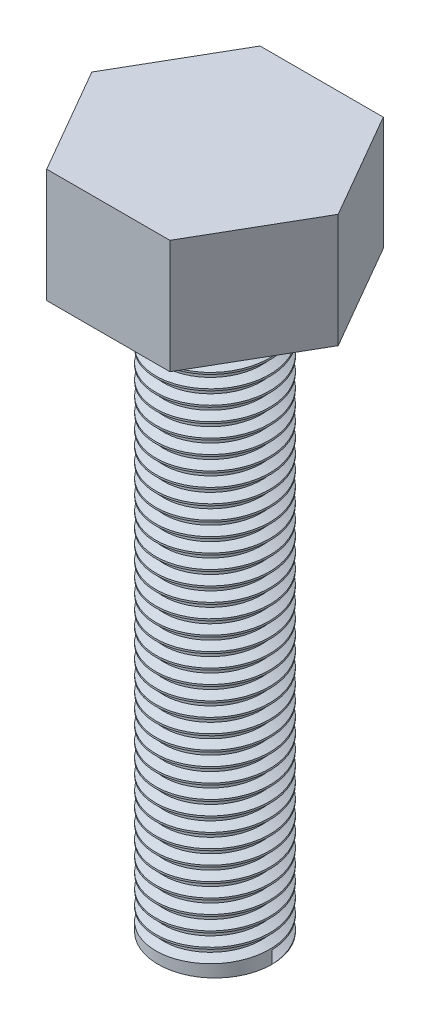
from build123d import *

# Parameters (mm, degrees)
SKETCH1_R           = 4
BOSS_EXTRUDE1_DEPTH = 40
BOSS_EXTRUDE2_DEPTH = 8
THREAD1_PITCH       = 1


with BuildPart() as part:
    # Sketch1 → Boss-Extrude1 (new body)
    with BuildSketch(Plane(origin=(0, 0, 0), x_dir=(1, 0, 0), z_dir=(0, 1, 0))):
        with Locations(Location((0, 0, 0), (0, 0, 270))):
            Circle(SKETCH1_R)
    extrude(amount=-BOSS_EXTRUDE1_DEPTH)

    # Sketch2 → Boss-Extrude2 (add)
    with BuildSketch(Plane(origin=(0, 0, 0), x_dir=(1, 0, 0), z_dir=(0, 1, 0))):
        Polygon((-8.660254038, 0), (-4.330127019, -7.5), (4.330127019, -7.5), (8.660254038, 0), (4.330127019, 7.5), (-4.330127019, 7.5), align=None)
    extrude(amount=BOSS_EXTRUDE2_DEPTH)

    # Thread1: arcs per turn and ends read off the stored shape
    # Thread1: the profile of Thread Profile1 profile screwed along a right-hand helix through 40 turns, 8 arcs to a turn; built about Z, then put on its axis
    thread1_z = Axis((0, 0, 0), (0, 0, 1))
    thread1_corners = [(4.0003, 0, -0.000173205), (4.0003, 0, 0.875173202), (3.458734125, 0, 0.562499999), (3.458734125, 0, 0.312499999)]
    with BuildLine(mode=Mode.PRIVATE) as thread1_profile:
        Line(thread1_corners[0], thread1_corners[1])
        Line(thread1_corners[1], thread1_corners[2])
        Line(thread1_corners[2], thread1_corners[3])
        Line(thread1_corners[3], thread1_corners[0])
    thread1_cap = Face(thread1_profile.wire())
    thread1_turn_angles = [0, 22.5, 45, 67.5, 90, 112.5, 135, 157.5, 180, 202.5, 225, 247.5, 270, 292.5, 315, 337.5, 360]
    thread1_turn_weights = [1, 0.9238795325112867, 1, 0.9238795325112867, 1, 0.9238795325112867, 1, 0.9238795325112867, 1, 0.9238795325112867, 1, 0.9238795325112867, 1, 0.9238795325112867, 1, 0.9238795325112867, 1]
    thread1_turn_rails = [Edge.make_bspline([Vector(p[0], p[1], 0).rotate(thread1_z, thread1_turn_angles[k]) / thread1_turn_weights[k] + Vector(0, 0, p[2] + THREAD1_PITCH * thread1_turn_angles[k] / 360) for k in range(17)], [0, 0, 0, 1, 1, 2, 2, 3, 3, 4, 4, 5, 5, 6, 6, 7, 7, 8, 8, 8], 2, thread1_turn_weights) for p in thread1_corners]
    thread1_turn_sides = [Face.make_surface_from_curves(thread1_turn_rails[p[0]], thread1_turn_rails[p[1]]) for p in [(0, 1), (1, 2), (2, 3), (3, 0)]]
    thread1 = Plane(origin=(0, -40, 0), x_dir=(1, 0, 0), z_dir=(0, 1, 0)) * Solid(Shell([*[p.moved(Location((0, 0, THREAD1_PITCH * i))) for i in range(40) for p in thread1_turn_sides], thread1_cap, thread1_cap.rotate(thread1_z, 14400).moved(Location((0, 0, THREAD1_PITCH * 14400 / 360)))]))
    add(thread1, mode=Mode.SUBTRACT)


solid = part.part
